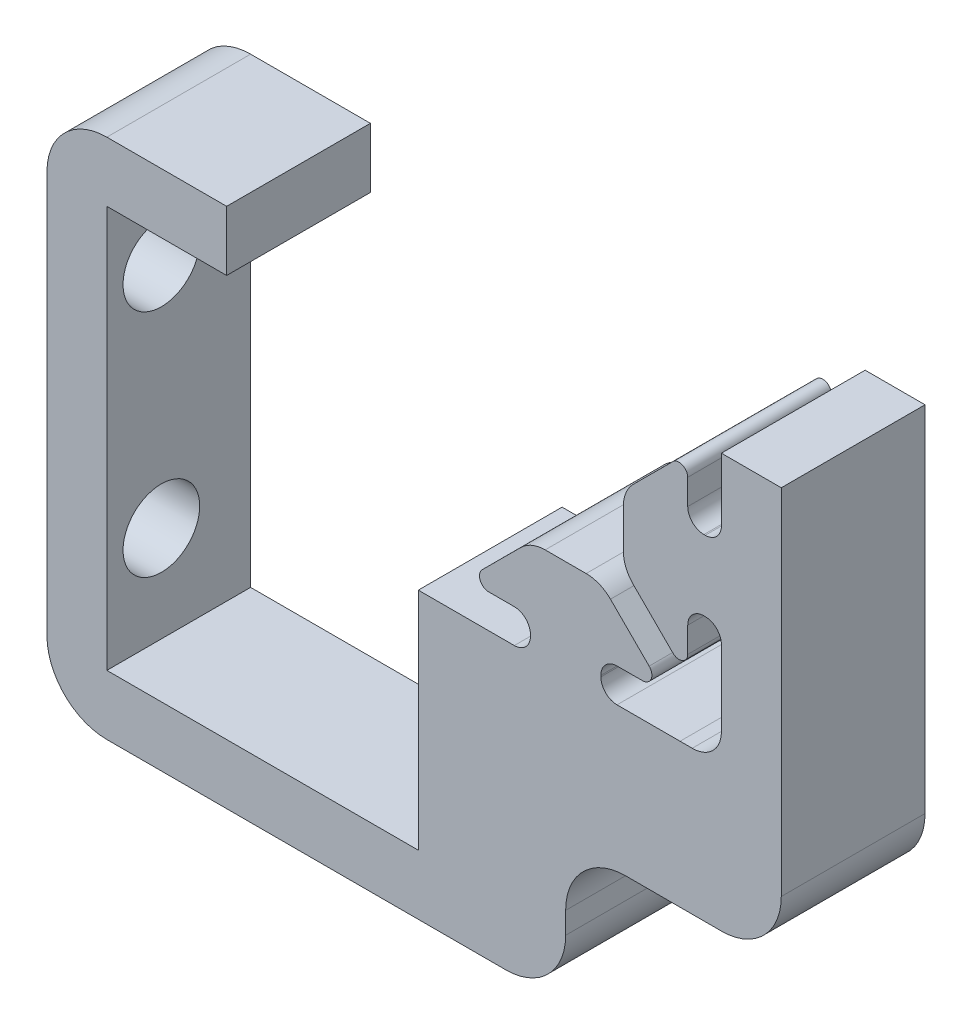
from build123d import *

# Parameters (mm, degrees)
BOSS_EXTRUDE1_DEPTH = 12
FILLET1_R           = 5
FILLET2_R           = 5
CUT_EXTRUDE1_REACH  = 74.499
SKETCH3_R           = 3.2
CHAMFER1_SIZE       = 0.2


with BuildPart() as part:
    # Sketch2 → Boss-Extrude1 (new body)
    with BuildSketch(Plane.XY):
        with BuildLine():
            Line((-10.5918, -13), (-5.317126718, -13))
            Line((-5.317126718, -13), (-4.287512407, -13))
            ThreePointArc((-4.287512407, -13), (-3.333616586, -12.604883414), (-2.9385, -11.650987593))
            Line((-2.9385, -11.650987593), (-2.9385, -11.539212407))
            ThreePointArc((-2.9385, -11.539212407), (-3.333616586, -10.585316586), (-4.287512407, -10.1902))
            Line((-4.287512407, -10.1902), (-6.416408329, -10.1902))
            ThreePointArc((-6.416408329, -10.1902), (-7.137514675, -9.708134418), (-6.967711912, -8.857517813))
            Line((-6.967711912, -8.857517813), (-3.740331666, -5.636015806))
            ThreePointArc((-3.740331666, -5.636015806), (-2.808257752, -5.01414519), (-1.709253557, -4.7958))
            Line((-1.709253557, -4.7958), (1.709253557, -4.7958))
            ThreePointArc((1.709253557, -4.7958), (2.808257752, -5.01414519), (3.740331666, -5.636015806))
            Line((3.740331666, -5.636015806), (6.967711912, -8.857517813))
            ThreePointArc((6.967711912, -8.857517813), (7.137514675, -9.708134418), (6.416408329, -10.1902))
            Line((6.416408329, -10.1902), (4.287512407, -10.1902))
            ThreePointArc((4.287512407, -10.1902), (3.333616586, -10.585316586), (2.9385, -11.539212407))
            Line((2.9385, -11.539212407), (2.9385, -11.650987593))
            ThreePointArc((2.9385, -11.650987593), (3.333616586, -12.604883414), (4.287512407, -13))
            Line((4.287512407, -13), (5.317126718, -13))
            Line((5.317126718, -13), (9.550465633, -13))
            Line((9.550465633, -13), (10.564722121, -12.999847763))
            ThreePointArc((10.564722121, -12.999847763), (12.294654751, -12.29465435), (12.999847757, -10.564721553))
            Line((12.999847757, -10.564721553), (13, -9.550422515))
            Line((13, -9.550422515), (13, -6.3330836))
            Line((13, -6.3330836), (13, -5.3170836))
            Line((13, -5.3170836), (13, -4.287469289))
            ThreePointArc((13, -4.287469289), (12.604883414, -3.333573468), (11.650987593, -2.938456882))
            Line((11.650987593, -2.938456882), (11.539212407, -2.938456882))
            ThreePointArc((11.539212407, -2.938456882), (10.585316586, -3.333573468), (10.1902, -4.287469289))
            Line((10.1902, -4.287469289), (10.1902, -6.402089023))
            ThreePointArc((10.1902, -6.402089023), (9.74154152, -7.073969797), (8.94902056, -6.917034355))
            Line((8.94902056, -6.917034355), (5.652895046, -3.628441884))
            ThreePointArc((5.652895046, -3.628441884), (5.027976112, -2.694919539), (4.8085, -1.593185507))
            Line((4.8085, -1.593185507), (4.8085, 1.593185507))
            ThreePointArc((4.8085, 1.593185507), (5.027976112, 2.694919539), (5.652895046, 3.628441884))
            Line((5.652895046, 3.628441884), (8.94902056, 6.917034355))
            ThreePointArc((8.94902056, 6.917034355), (9.74154152, 7.073969797), (10.1902, 6.402089023))
            Line((10.1902, 6.402089023), (10.1902, 4.287469289))
            ThreePointArc((10.1902, 4.287469289), (10.585316586, 3.333573468), (11.539212407, 2.938456882))
            Line((11.539212407, 2.938456882), (11.650987593, 2.938456882))
            ThreePointArc((11.650987593, 2.938456882), (12.604883414, 3.333573468), (13, 4.287469289))
            Line((13, 4.287469289), (13, 5.3170836))
            Line((13, 5.3170836), (13, 6.3330836))
            Line((13, 6.3330836), (13, 9.550422515))
            Line((13, 9.550422515), (18, 9.550422515))
            Line((18, 9.550422515), (18, -25))
            Line((18, -25), (0, -25))
            Line((0, -25), (0, -36.8026666))
            Line((0, -36.8026666), (-12, -36.8026666))
            Line((-12, -36.8026666), (-43.3, -36.8026666))
            Line((-43.3, -36.8026666), (-43.3, -31.8026666))
            Line((-43.3, -31.8026666), (-43.3, 6.7473334))
            Line((-43.3, 6.7473334), (-28.3, 6.7473334))
            Line((-28.3, 6.7473334), (-28.3, 1.7473334))
            Line((-28.3, 1.7473334), (-38.3, 1.7473334))
            Line((-38.3, 1.7473334), (-38.3, -31.8026666))
            Line((-38.3, -31.8026666), (-12.3, -31.8026666))
            Line((-12.3, -31.8026666), (-12.3, -13))
            Line((-12.3, -13), (-10.5918, -13))
        make_face()
    extrude(amount=BOSS_EXTRUDE1_DEPTH)

    # Fillet1
    fillet1_edges = [part.edges().sort_by_distance(p)[0] for p in [
        (0, -25, 6),
        (0, -36.8026666, 6),
        (18, -25, 6),
    ]]
    fillet(fillet1_edges, radius=FILLET1_R)

    # Fillet2
    fillet2_edges = [part.edges().sort_by_distance(p)[0] for p in [
        (-43.3, 6.7473334, 6),
        (-43.3, -36.8026666, 6),
    ]]
    fillet(fillet2_edges, radius=FILLET2_R)

    # Sketch3 → Cut-Extrude1 (cut, up to next)
    with BuildSketch(Plane.ZY.offset(43.3), mode=Mode.PRIVATE) as cut_extrude1_sk1:
        with Locations((7.45, -23.7926666)):
            Circle(SKETCH3_R)
    cut_extrude1_tool1 = extrude(cut_extrude1_sk1.sketch, amount=-CUT_EXTRUDE1_REACH, mode=Mode.PRIVATE) & part.part
    # Sketch3 → Cut-Extrude1 (cut, up to next)
    with BuildSketch(Plane.ZY.offset(43.3), mode=Mode.PRIVATE) as cut_extrude1_sk2:
        with Locations((7.45, -4.5926666)):
            Circle(SKETCH3_R)
    cut_extrude1_tool2 = extrude(cut_extrude1_sk2.sketch, amount=-CUT_EXTRUDE1_REACH, mode=Mode.PRIVATE) & part.part
    add(cut_extrude1_tool1.solids().sort_by_distance((-43.3, -23.792667, 7.45))[0], mode=Mode.SUBTRACT)
    add(cut_extrude1_tool2.solids().sort_by_distance((-43.3, -4.592667, 7.45))[0], mode=Mode.SUBTRACT)

    # Chamfer1
    chamfer1_edges = [part.edges().sort_by_distance(p)[0] for p in [
        (-43.3, -4.5926666, 4.25),
        (-43.3, -23.7926666, 4.25),
    ]]
    chamfer(chamfer1_edges, length=CHAMFER1_SIZE)


solid = part.part
